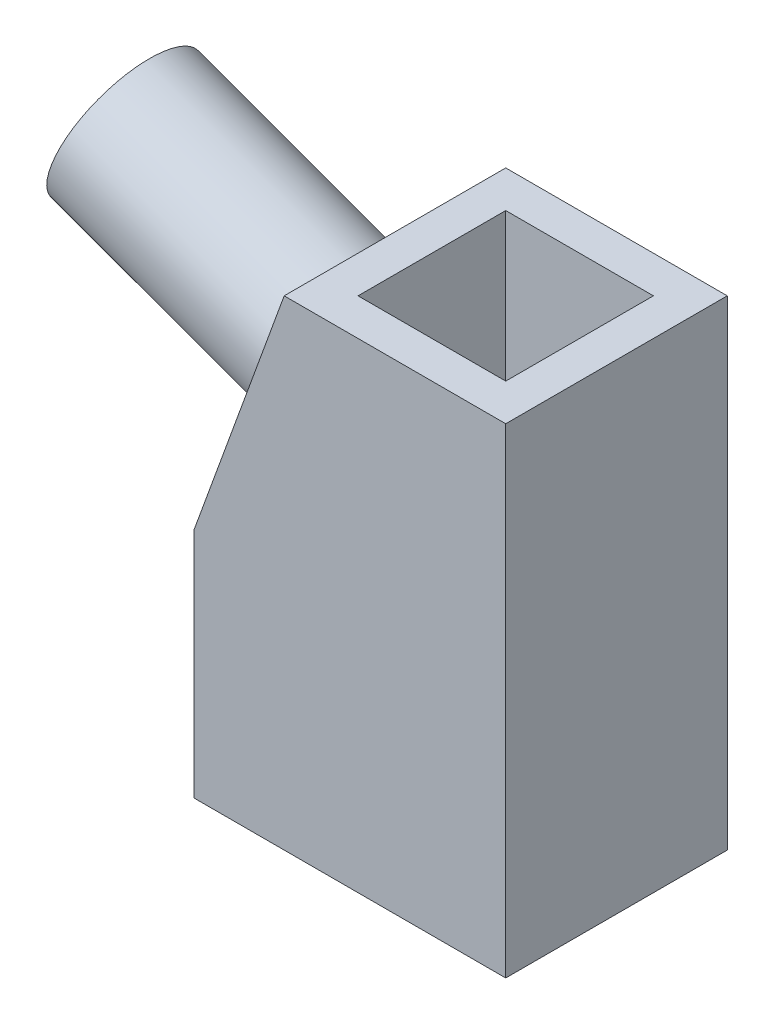
from build123d import *

# Parameters (mm, degrees)
SKETCH1_W           = 53.594
SKETCH1_H           = 38.1
BOSS_EXTRUDE1_DEPTH = 82.55
CUT_EXTRUDE1_DEPTH  = 106.538757506
SKETCH5_W           = 25.4
SKETCH5_H           = 25.4
CUT_EXTRUDE2_DEPTH  = 106.538757506
SKETCH6_R           = 12.6365
BOSS_EXTRUDE2_DEPTH = 41.275


with BuildPart() as part:
    # Sketch1 → Boss-Extrude1 (new body)
    with BuildSketch(Plane(origin=(0, 0, 0), x_dir=(1, 0, 0), z_dir=(0, 1, 0))):
        with Locations((26.797, 19.05)):
            Rectangle(SKETCH1_W, SKETCH1_H)
    extrude(amount=BOSS_EXTRUDE1_DEPTH)

    # Sketch4 → Cut-Extrude1 (cut, through all)
    with BuildSketch(Plane.XY):
        Polygon((0, 39.980584863), (15.494, 82.55), (0, 82.55), align=None)
    extrude(amount=-CUT_EXTRUDE1_DEPTH, mode=Mode.SUBTRACT)

    # Sketch5 → Cut-Extrude2 (cut, through all)
    with BuildSketch(Plane(origin=(0, 82.55, 0), x_dir=(1, 0, 0), z_dir=(0, 1, 0))):
        with Locations((34.544, 19.05)):
            Rectangle(SKETCH5_W, SKETCH5_H)
    extrude(amount=-CUT_EXTRUDE2_DEPTH, mode=Mode.SUBTRACT)

    # Sketch6 → Boss-Extrude2 (add)
    with BuildSketch(Plane(origin=(-12.849512289, 4.676839998, 0), x_dir=(0, 0, 1), z_dir=(-0.9396926207859096, 0.3420201433256656, 0))):
        with Locations((-19.05, 60.220173259)):
            Circle(SKETCH6_R)
    extrude(amount=BOSS_EXTRUDE2_DEPTH)


solid = part.part
